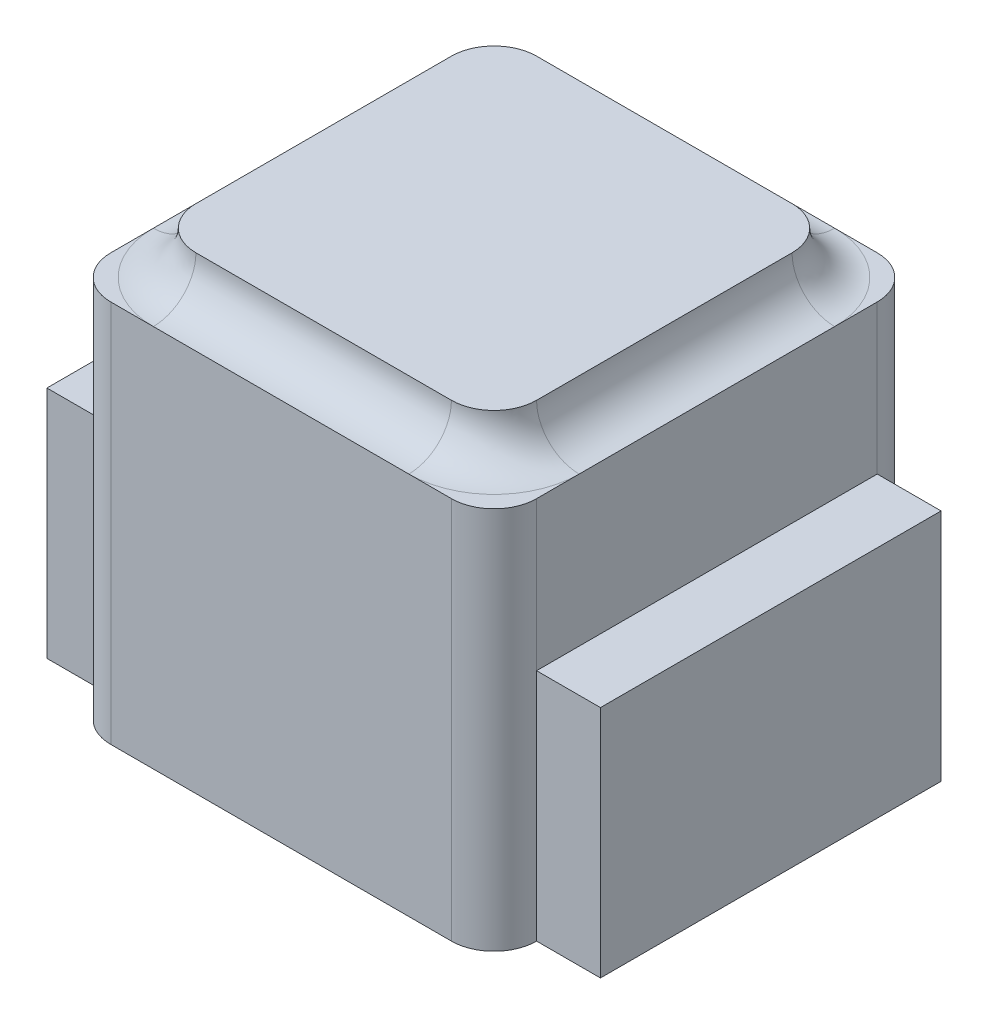
from build123d import *

# Parameters (mm, degrees)
BOSS_EXTRUDE1_DEPTH = 10
SKETCH2_W           = 13
SKETCH2_H           = 8
BOSS_EXTRUDE2_DEPTH = 5.5
SKETCH3_W           = 7
SKETCH3_H           = 7
SKETCH3_R           = 1.75
CUT_EXTRUDE1_DEPTH  = 8
SKETCH4_W           = 1
SKETCH4_H           = 2
BOSS_EXTRUDE3_DEPTH = 7
SKETCH5_W           = 10
SKETCH5_H           = 10
SKETCH5_W_2         = 8
SKETCH5_H_2         = 8
CUT_EXTRUDE2_DEPTH  = 1
FILLET1_R           = 1


with BuildPart() as part:
    # Sketch1 → Boss-Extrude1 (new body)
    with BuildSketch(Plane(origin=(0, 0, 0), x_dir=(1, 0, 0), z_dir=(0, 1, 0))):
        with BuildLine():
            Line((-4, -5), (4, -5))
            ThreePointArc((4, -5), (4.707106781, -4.707106781), (5, -4))
            Line((5, -4), (5, 4))
            ThreePointArc((5, 4), (4.707106781, 4.707106781), (4, 5))
            Line((4, 5), (-4, 5))
            ThreePointArc((-4, 5), (-4.707106781, 4.707106781), (-5, 4))
            Line((-5, 4), (-5, -4))
            ThreePointArc((-5, -4), (-4.707106781, -4.707106781), (-4, -5))
        make_face()
    extrude(amount=BOSS_EXTRUDE1_DEPTH)

    # Sketch2 → Boss-Extrude2 (add)
    with BuildSketch(Plane(origin=(0, 0, 0), x_dir=(1, 0, 0), z_dir=(0, 1, 0))):
        Rectangle(SKETCH2_W, SKETCH2_H)
    extrude(amount=BOSS_EXTRUDE2_DEPTH)

    # Sketch3 → Cut-Extrude1 (cut)
    with BuildSketch(Plane.XZ):
        Rectangle(SKETCH3_W, SKETCH3_H)
        with Locations(Location((0, 0, 0), (0, 0, 270))):
            Circle(SKETCH3_R, mode=Mode.SUBTRACT)
    extrude(amount=-CUT_EXTRUDE1_DEPTH, mode=Mode.SUBTRACT)

    # Sketch4 → Boss-Extrude3 (add)
    with BuildSketch(Plane(origin=(-3.5, 0, 0), x_dir=(0, 0, -1), z_dir=(1, 0, 0))):
        with Locations((0, 1)):
            Rectangle(SKETCH4_W, SKETCH4_H)
    extrude(amount=BOSS_EXTRUDE3_DEPTH)

    # Sketch5 → Cut-Extrude2 (cut)
    with BuildSketch(Plane(origin=(0, 10, 0), x_dir=(1, 0, 0), z_dir=(0, 1, 0))):
        Rectangle(SKETCH5_W, SKETCH5_H)
        Rectangle(SKETCH5_W_2, SKETCH5_H_2, mode=Mode.SUBTRACT)
    extrude(amount=-CUT_EXTRUDE2_DEPTH, mode=Mode.SUBTRACT)

    # Fillet1
    fillet1_edges = [part.edges().sort_by_distance(p)[0] for p in [
        (-4, 9, 0),
        (0, 9, 4),
        (4, 9, 0),
        (0, 9, -4),
        (-4, 9.5, -4),
        (4, 9.5, -4),
        (4, 9.5, 4),
        (-4, 9.5, 4),
    ]]
    fillet(fillet1_edges, radius=FILLET1_R - 0.0001)  # a hair under: the kernel refuses the full size


solid = part.part
